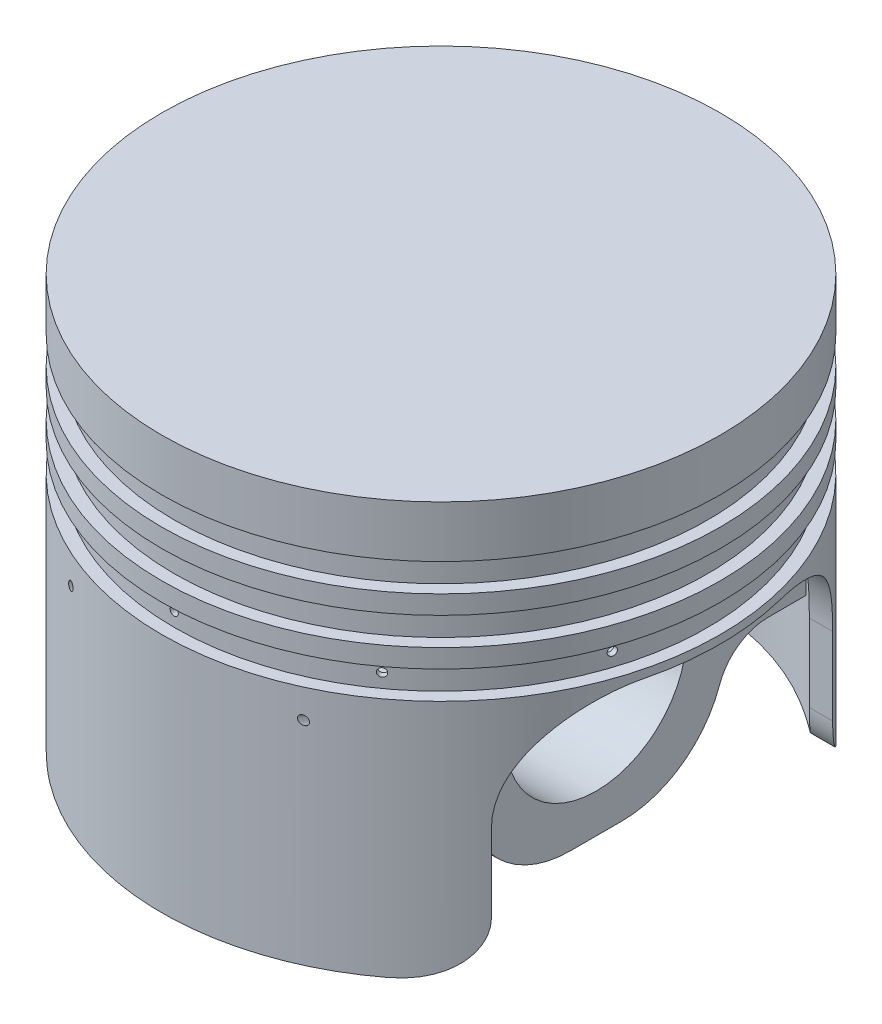
from build123d import *

# Parameters (mm, degrees)
CUT_EXTRUDE2_DEPTH        = 111.598372502
CUT_EXTRUDE2_DEPTH_BACK   = 111.598372502
SKETCH5_W                 = 66
SKETCH5_H                 = 45
SKETCH6_W                 = 4.8
SKETCH6_H                 = 5.4
LPATTERN2_COUNT           = 2
LPATTERN2_PITCH           = 9
FILLET1_R                 = 20
FILLET4_R                 = 3
LPATTERN4_COPY_1_SKETCH_W = 4.8
LPATTERN4_COPY_1_SKETCH_H = 5.4
LPATTERN4_COPY_2_SKETCH_W = 4.8
LPATTERN4_COPY_2_SKETCH_H = 5.4
SKETCH19_W                = 15
SKETCH19_H                = 50
BOSS_EXTRUDE3_DEPTH       = 70
SKETCH20_R                = 17.5
CUT_EXTRUDE4_DEPTH        = 128.953116584
FILLET7_R                 = 20
FILLET8_R                 = 10
CIRPATTERN3_COUNT         = 10
BOSS_EXTRUDE4_REACH       = 126.728
BOSS_EXTRUDE4_END_RADIUS  = 50.5
SKETCH24_W                = 15
SKETCH24_H                = 25
FILLET10_R                = 10
FILLET11_R                = 10
BOSS_EXTRUDE5_REACH       = 126.728
BOSS_EXTRUDE5_END_RADIUS  = 50.5
SKETCH25_W                = 15
SKETCH25_H                = 25
FILLET12_R                = 10
BOSS_EXTRUDE6_REACH       = 126.728
BOSS_EXTRUDE6_END_RADIUS  = 50.5
SKETCH26_W                = 15
SKETCH26_H                = 25
FILLET13_R                = 10
BOSS_EXTRUDE7_REACH       = 126.728
BOSS_EXTRUDE7_END_RADIUS  = 50.5
SKETCH27_W                = 15
SKETCH27_H                = 25
FILLET14_R                = 10
SKETCH42_R                = 0.8
CUT_EXTRUDE5_DEPTH        = 50
MIRROR2_COPY_1_SKETCH_R   = 0.8
MIRROR2_COPY_1_DEPTH      = 50


with BuildPart() as part:
    # Sketch4 → Revolve2 (revolve)
    with BuildSketch(Plane.XY, mode=Mode.PRIVATE) as revolve2_sk:
        Polygon((0, 0), (0, -9.13), (50.5, -9.13), (50.5, -80), (54, -80), (54, 0), align=None)
    revolve(revolve2_sk.sketch.rotate(Axis((0, 0, 0), (0, -1, 0)), 180), axis=Axis((0, 0, 0), (0, -1, 0)))

    # Sketch5 → Cut-Extrude2 (cut, two sides: drawn at the far end of the back side and taken through both)
    with BuildSketch(Plane(origin=(0, 0, 0), x_dir=(0, 0, -1), z_dir=(1, 0, 0)).offset(-CUT_EXTRUDE2_DEPTH_BACK)):
        with Locations((0, -57.5)):
            Rectangle(SKETCH5_W, SKETCH5_H)
    extrude(amount=CUT_EXTRUDE2_DEPTH + CUT_EXTRUDE2_DEPTH_BACK, mode=Mode.SUBTRACT)

    # Sketch6 → Cut-Revolve2 (revolve, cut)
    with BuildSketch(Plane(origin=(0, 0, 0), x_dir=(0, 0, -1), z_dir=(1, 0, 0)), mode=Mode.PRIVATE) as cut_revolve2_sk:
        with Locations((54, -12.7)):
            Rectangle(SKETCH6_W, SKETCH6_H)
    cut_revolve2 = revolve(cut_revolve2_sk.sketch.rotate(Axis((0, 0, 0), (0, -1, 0)), 270), axis=Axis((0, 0, 0), (0, -1, 0)), mode=Mode.SUBTRACT)

    # LPattern2: Cut-Revolve2 ×2
    with Locations(*[(0, -i * LPATTERN2_PITCH, 0) for i in range(1, LPATTERN2_COUNT)]):
        add(cut_revolve2, mode=Mode.SUBTRACT)

    # Fillet1
    # the kernel refuses this fillet: 20 mm, written as the material it adds along each edge
    with BuildSketch(Plane(origin=(-92.743420546, -35, -33), x_dir=(0, 0, 1), z_dir=(1, 0, 0))) as fillet1_piece_1_section:
        with BuildLine():
            CenterArc((FILLET1_R, FILLET1_R), FILLET1_R, 180, 90)
            Line((0, FILLET1_R), (0, 0))
            Line((0, 0), (FILLET1_R, 0))
        make_face()
    fillet1_piece_1 = extrude(amount=104.517120699, mode=Mode.PRIVATE)
    fillet1_piece_1 = fillet1_piece_1 - Plane(origin=(0, -39.583946122, 0), x_dir=(-1, 0, 0), z_dir=(0, -1, 0)) * Cylinder(50.5, 290, mode=Mode.PRIVATE)
    fillet1_piece_1 = fillet1_piece_1 & Plane(origin=(0, -39.583946122, 0), x_dir=(-1, 0, 0), z_dir=(0, 1, 0)) * Cylinder(54, 290, mode=Mode.PRIVATE)
    add(fillet1_piece_1)
    with BuildSketch(Plane(origin=(-11.773700153, -35, -33), x_dir=(0, -1, 0), z_dir=(1, 0, 0))) as fillet1_piece_2_section:
        with BuildLine():
            CenterArc((FILLET1_R, -FILLET1_R), FILLET1_R, 90, 90)
            Line((0, -FILLET1_R), (0, 0))
            Line((0, 0), (FILLET1_R, 0))
        make_face()
    fillet1_piece_2 = extrude(amount=104.517120699, mode=Mode.PRIVATE)
    fillet1_piece_2 = fillet1_piece_2 - Plane(origin=(0, -39.583957247, 0), x_dir=(-1, 0, 0), z_dir=(0, -1, 0)) * Cylinder(50.5, 290, mode=Mode.PRIVATE)
    fillet1_piece_2 = fillet1_piece_2 & Plane(origin=(0, -39.583957247, 0), x_dir=(-1, 0, 0), z_dir=(0, 1, 0)) * Cylinder(54, 290, mode=Mode.PRIVATE)
    add(fillet1_piece_2)
    with BuildSketch(Plane(origin=(11.773700153, -35, 33), x_dir=(0, 0, -1), z_dir=(-1, 0, 0))) as fillet1_piece_3_section:
        with BuildLine():
            CenterArc((FILLET1_R, FILLET1_R), FILLET1_R, 180, 90)
            Line((0, FILLET1_R), (0, 0))
            Line((0, 0), (FILLET1_R, 0))
        make_face()
    fillet1_piece_3 = extrude(amount=104.517120699, mode=Mode.PRIVATE)
    fillet1_piece_3 = fillet1_piece_3 - Plane(origin=(0, -39.583945258, 0), x_dir=(-1, 0, 0), z_dir=(0, -1, 0)) * Cylinder(50.5, 290, mode=Mode.PRIVATE)
    fillet1_piece_3 = fillet1_piece_3 & Plane(origin=(0, -39.583945258, 0), x_dir=(-1, 0, 0), z_dir=(0, 1, 0)) * Cylinder(54, 290, mode=Mode.PRIVATE)
    add(fillet1_piece_3)
    with BuildSketch(Plane(origin=(92.743420546, -35, 33), x_dir=(0, 0, -1), z_dir=(-1, 0, 0))) as fillet1_piece_4_section:
        with BuildLine():
            CenterArc((FILLET1_R, FILLET1_R), FILLET1_R, 180, 90)
            Line((0, FILLET1_R), (0, 0))
            Line((0, 0), (FILLET1_R, 0))
        make_face()
    fillet1_piece_4 = extrude(amount=104.517120699, mode=Mode.PRIVATE)
    fillet1_piece_4 = fillet1_piece_4 - Plane(origin=(0, -39.583946122, 0), x_dir=(-1, 0, 0), z_dir=(0, -1, 0)) * Cylinder(50.5, 290, mode=Mode.PRIVATE)
    fillet1_piece_4 = fillet1_piece_4 & Plane(origin=(0, -39.583946122, 0), x_dir=(-1, 0, 0), z_dir=(0, 1, 0)) * Cylinder(54, 290, mode=Mode.PRIVATE)
    add(fillet1_piece_4)

    # Fillet4
    fillet4_edges = [part.edges().sort_by_distance(p)[0] for p in [
        (50.5, -9.13, 0),
    ]]
    fillet(fillet4_edges, radius=FILLET4_R)

    # LPattern4 copy 1 sketch → LPattern4 copy 1 (revolve, cut)
    with BuildSketch(Plane(origin=(0, -18, 0), x_dir=(0, 0, -1), z_dir=(1, 0, 0))):
        with Locations((54, -12.7)):
            Rectangle(LPATTERN4_COPY_1_SKETCH_W, LPATTERN4_COPY_1_SKETCH_H)
    revolve(axis=Axis((0, -18, 0), (0, -1, 0)), mode=Mode.SUBTRACT)

    # LPattern4 copy 2 sketch → LPattern4 copy 2 (revolve, cut)
    with BuildSketch(Plane(origin=(0, -9, 0), x_dir=(0, 0, -1), z_dir=(1, 0, 0))):
        with Locations((54, -12.7)):
            Rectangle(LPATTERN4_COPY_2_SKETCH_W, LPATTERN4_COPY_2_SKETCH_H)
    revolve(axis=Axis((0, -9, 0), (0, -1, 0)), mode=Mode.SUBTRACT)

    # Sketch19 → Boss-Extrude3 (add)
    with BuildSketch(Plane.XZ.offset(9.13)):
        with Locations((22.5, 0)):
            Rectangle(SKETCH19_W, SKETCH19_H)
        with Locations((-22.5, 0)):
            Rectangle(SKETCH19_W, SKETCH19_H)
    extrude(amount=BOSS_EXTRUDE3_DEPTH)

    # Sketch20 → Cut-Extrude4 (cut, through all)
    with BuildSketch(Plane.ZY.offset(30)):
        with Locations(Location((0, -54.13, 0), (0, 0, 270))):
            Circle(SKETCH20_R)
    extrude(amount=-CUT_EXTRUDE4_DEPTH, mode=Mode.SUBTRACT)

    # Fillet7
    fillet7_edges = [part.edges().sort_by_distance(p)[0] for p in [
        (-22.5, -79.13, 25),
        (-22.5, -79.13, -25),
        (22.5, -79.13, 25),
        (22.5, -79.13, -25),
    ]]
    fillet(fillet7_edges, radius=FILLET7_R)

    # Fillet8
    # the kernel refuses this fillet: 10 mm, written as the material it takes off along each edge
    with BuildSketch(Plane(origin=(-67.743420546, -80, -33), x_dir=(0, 0, -1), z_dir=(1, 0, 0)), Plane(origin=(67.743420546, -80, 33), x_dir=(0, 0, 1), z_dir=(-1, 0, 0))) as fillet8_piece_1:
        with BuildLine():
            CenterArc((FILLET8_R, FILLET8_R), FILLET8_R, 180, 90)
            Line((0, FILLET8_R), (0, 0))
            Line((0, 0), (FILLET8_R, 0))
        make_face()
    extrude(amount=54.517120699, mode=Mode.SUBTRACT)
    with BuildSketch(Plane(origin=(13.226299847, -80, -33), x_dir=(0, 1, 0), z_dir=(1, 0, 0)), Plane(origin=(-13.226299847, -80, 33), x_dir=(0, 1, 0), z_dir=(-1, 0, 0))) as fillet8_piece_2:
        with BuildLine():
            CenterArc((FILLET8_R, -FILLET8_R), FILLET8_R, 90, 90)
            Line((0, -FILLET8_R), (0, 0))
            Line((0, 0), (FILLET8_R, 0))
        make_face()
    extrude(amount=54.517120699, mode=Mode.SUBTRACT)

    # Sketch23 → 1/16 (0.0625) Diameter Hole3 (revolve, cut)
    with BuildSketch(Plane(origin=(0, -30.7, 43), x_dir=(0, 1, 0), z_dir=(1, 0, 0))):
        Polygon((0, 0), (0, 12.476933116), (0.79375, 12), (0.79375, 0.635), (1.42875, 0), align=None)
    f_1_16_0_0625_diameter_hole3 = revolve(axis=Axis((0, -30.7, 36.65), (0, 0, 1)), mode=Mode.SUBTRACT)

    # CirPattern3: 1/16 (0.0625) Diameter Hole3 ×10 about axis
    cirpattern3_axis = Axis((0, -18, 0), (0, 1, 0))
    for i in range(1, CIRPATTERN3_COUNT):
        add(f_1_16_0_0625_diameter_hole3.rotate(cirpattern3_axis, i * 360 / CIRPATTERN3_COUNT), mode=Mode.SUBTRACT)

    # Boss-Extrude4: up to this cylinder (the profile starts inside it)
    boss_extrude4_end = Plane(origin=(0, -46.63, 0), z_dir=(0, 1, 0)) * Cylinder(BOSS_EXTRUDE4_END_RADIUS, 355.456, mode=Mode.PRIVATE)
    # Sketch24 → Boss-Extrude4 (add, up to the surface)
    with BuildSketch(Plane.XY.offset(25), mode=Mode.PRIVATE) as boss_extrude4_sk1:
        with Locations((22.5, -46.63)):
            Rectangle(SKETCH24_W, SKETCH24_H)
    boss_extrude4_tool1 = extrude(boss_extrude4_sk1.sketch, amount=BOSS_EXTRUDE4_REACH, mode=Mode.PRIVATE) & boss_extrude4_end
    add(boss_extrude4_tool1.solids().sort_by_distance((22.5, -46.63, 25))[0])

    # Fillet10
    fillet10_edges = [part.edges().sort_by_distance(p)[0] for p in [
        (22.5, -59.13, 25),
    ]]
    fillet(fillet10_edges, radius=FILLET10_R)

    # Fillet11
    fillet11_edges = [part.edges().sort_by_distance(p)[0] for p in [
        (22.5, -34.13, 25),
    ]]
    fillet(fillet11_edges, radius=FILLET11_R)

    # Boss-Extrude5: up to this cylinder (the profile starts inside it)
    boss_extrude5_end = Plane(origin=(0, -46.63, 0), z_dir=(0, 1, 0)) * Cylinder(BOSS_EXTRUDE5_END_RADIUS, 355.456, mode=Mode.PRIVATE)
    # Sketch25 → Boss-Extrude5 (add, up to the surface)
    with BuildSketch(Plane(origin=(0, 0, -25), x_dir=(-1, 0, 0), z_dir=(0, 0, -1)), mode=Mode.PRIVATE) as boss_extrude5_sk1:
        with Locations((-22.5, -46.63)):
            Rectangle(SKETCH25_W, SKETCH25_H)
    boss_extrude5_tool1 = extrude(boss_extrude5_sk1.sketch, amount=BOSS_EXTRUDE5_REACH, mode=Mode.PRIVATE) & boss_extrude5_end
    add(boss_extrude5_tool1.solids().sort_by_distance((22.5, -46.63, -25))[0])

    # Fillet12
    fillet12_edges = [part.edges().sort_by_distance(p)[0] for p in [
        (22.5, -59.13, -25),
        (22.5, -34.13, -25),
    ]]
    fillet(fillet12_edges, radius=FILLET12_R)

    # Boss-Extrude6: up to this cylinder (the profile starts inside it)
    boss_extrude6_end = Plane(origin=(0, -46.63, 0), z_dir=(0, 1, 0)) * Cylinder(BOSS_EXTRUDE6_END_RADIUS, 355.456, mode=Mode.PRIVATE)
    # Sketch26 → Boss-Extrude6 (add, up to the surface)
    with BuildSketch(Plane(origin=(0, 0, -25), x_dir=(-1, 0, 0), z_dir=(0, 0, -1)), mode=Mode.PRIVATE) as boss_extrude6_sk1:
        with Locations((22.5, -46.63)):
            Rectangle(SKETCH26_W, SKETCH26_H)
    boss_extrude6_tool1 = extrude(boss_extrude6_sk1.sketch, amount=BOSS_EXTRUDE6_REACH, mode=Mode.PRIVATE) & boss_extrude6_end
    add(boss_extrude6_tool1.solids().sort_by_distance((-22.5, -46.63, -25))[0])

    # Fillet13
    fillet13_edges = [part.edges().sort_by_distance(p)[0] for p in [
        (-22.5, -59.13, -25),
        (-22.5, -34.13, -25),
    ]]
    fillet(fillet13_edges, radius=FILLET13_R)

    # Boss-Extrude7: up to this cylinder (the profile starts inside it)
    boss_extrude7_end = Plane(origin=(0, -46.63, 0), z_dir=(0, 1, 0)) * Cylinder(BOSS_EXTRUDE7_END_RADIUS, 355.456, mode=Mode.PRIVATE)
    # Sketch27 → Boss-Extrude7 (add, up to the surface)
    with BuildSketch(Plane.XY.offset(25), mode=Mode.PRIVATE) as boss_extrude7_sk1:
        with Locations((-22.5, -46.63)):
            Rectangle(SKETCH27_W, SKETCH27_H)
    boss_extrude7_tool1 = extrude(boss_extrude7_sk1.sketch, amount=BOSS_EXTRUDE7_REACH, mode=Mode.PRIVATE) & boss_extrude7_end
    add(boss_extrude7_tool1.solids().sort_by_distance((-22.5, -46.63, 25))[0])

    # Fillet14
    fillet14_edges = [part.edges().sort_by_distance(p)[0] for p in [
        (-22.5, -59.13, 25),
        (-22.5, -34.13, 25),
    ]]
    fillet(fillet14_edges, radius=FILLET14_R)

    # Sketch42 → Cut-Extrude5 (cut)
    with BuildSketch(Plane(origin=(22.5, -37, 54), x_dir=(1, 0, 0), z_dir=(0, 0.36796506850761784, 0.9298396143196871))):
        with Locations(Location((0, 0, 0), (0, 0, 270))):
            Circle(SKETCH42_R)
    cut_extrude5 = extrude(amount=-CUT_EXTRUDE5_DEPTH, mode=Mode.SUBTRACT)

    # Mirror1: Cut-Extrude5 across plane
    add(cut_extrude5.mirror(Plane(origin=(0, 0, 0), x_dir=(0, 0, 1), z_dir=(1, 0, 0))), mode=Mode.SUBTRACT)

    # Mirror2: Cut-Extrude5 across plane
    add(cut_extrude5.mirror(Plane.XY), mode=Mode.SUBTRACT)

    # Mirror2 copy 1 sketch → Mirror2 copy 1 (cut)
    with BuildSketch(Plane(origin=(-22.5, -37, -54), x_dir=(-1, 0, 0), z_dir=(0, 0.36796506850761784, -0.9298396143196871))):
        with Locations(Location((0, 0, 0), (0, 0, 270))):
            Circle(MIRROR2_COPY_1_SKETCH_R)
    extrude(amount=-MIRROR2_COPY_1_DEPTH, mode=Mode.SUBTRACT)


solid = part.part
